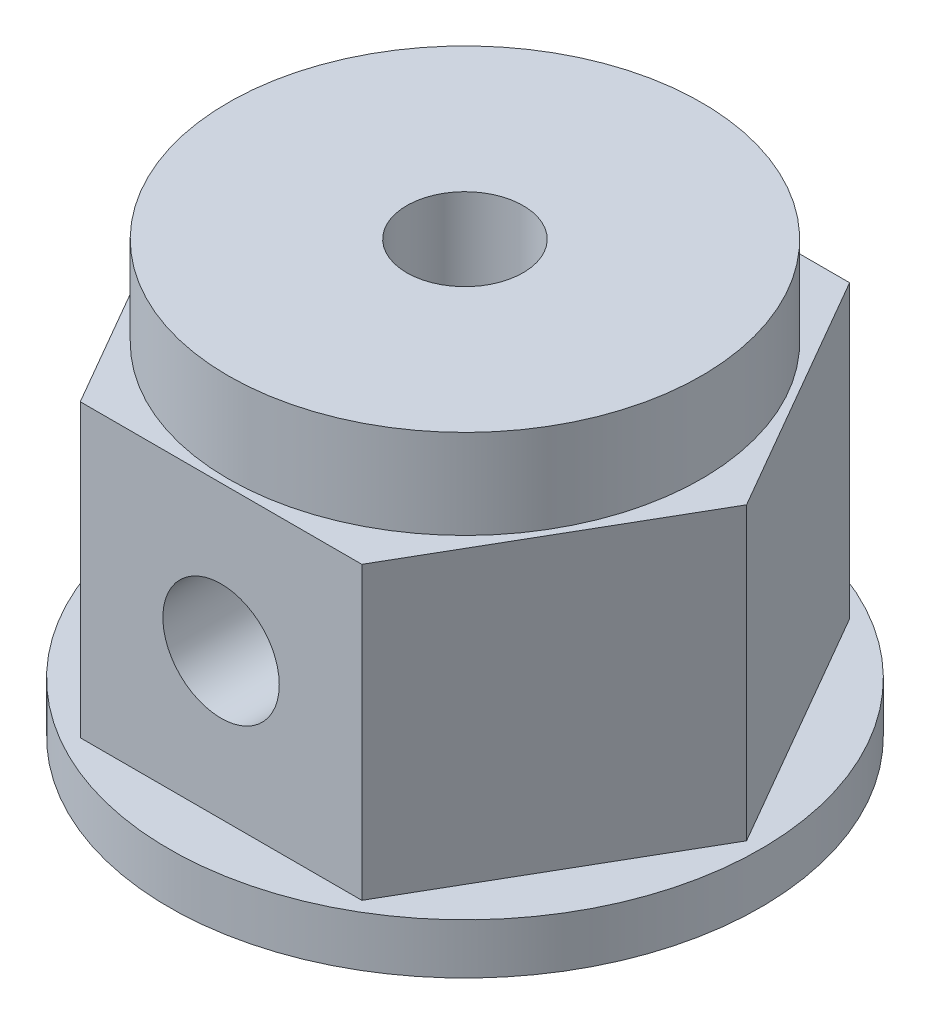
from build123d import *

# Parameters (mm, degrees)
BOSS_EXTRUDE1_DEPTH = 7.5
SKETCH2_R           = 6.1
BOSS_EXTRUDE2_DEPTH = 2.3
SKETCH3_R           = 7.625
BOSS_EXTRUDE3_DEPTH = 1.3
SKETCH4_R           = 1.5
CUT_EXTRUDE1_DEPTH  = 16.475504838
CUT_EXTRUDE2_REACH  = 20.646
SKETCH5_R           = 1.5


with BuildPart() as part:
    # Sketch1 → Boss-Extrude1 (new body)
    with BuildSketch(Plane(origin=(0, 0, 0), x_dir=(1, 0, 0), z_dir=(0, 1, 0))):
        Polygon((7.257292884, 0), (3.628646442, 6.285), (-3.628646442, 6.285), (-7.257292884, 0), (-3.628646442, -6.285), (3.628646442, -6.285), align=None)
    extrude(amount=BOSS_EXTRUDE1_DEPTH)

    # Sketch2 → Boss-Extrude2 (add)
    with BuildSketch(Plane(origin=(0, 7.5, 0), x_dir=(1, 0, 0), z_dir=(0, 1, 0))):
        Circle(SKETCH2_R)
    extrude(amount=BOSS_EXTRUDE2_DEPTH)

    # Sketch3 → Boss-Extrude3 (add)
    with BuildSketch(Plane.XZ):
        Circle(SKETCH3_R)
    extrude(amount=BOSS_EXTRUDE3_DEPTH)

    # Sketch4 → Cut-Extrude1 (cut, through all)
    with BuildSketch(Plane(origin=(0, 9.8, 0), x_dir=(1, 0, 0), z_dir=(0, 1, 0))):
        Circle(SKETCH4_R)
    extrude(amount=-CUT_EXTRUDE1_DEPTH, mode=Mode.SUBTRACT)

    # Sketch5 → Cut-Extrude2 (cut, up to next)
    with BuildSketch(Plane.XY.offset(6.285), mode=Mode.PRIVATE) as cut_extrude2_sk1:
        with Locations((0, 3.75)):
            Circle(SKETCH5_R)
    cut_extrude2_tool1 = extrude(cut_extrude2_sk1.sketch, amount=-CUT_EXTRUDE2_REACH, mode=Mode.PRIVATE) & part.part
    add(cut_extrude2_tool1.solids().sort_by_distance((0, 3.75, 6.285))[0], mode=Mode.SUBTRACT)


solid = part.part
